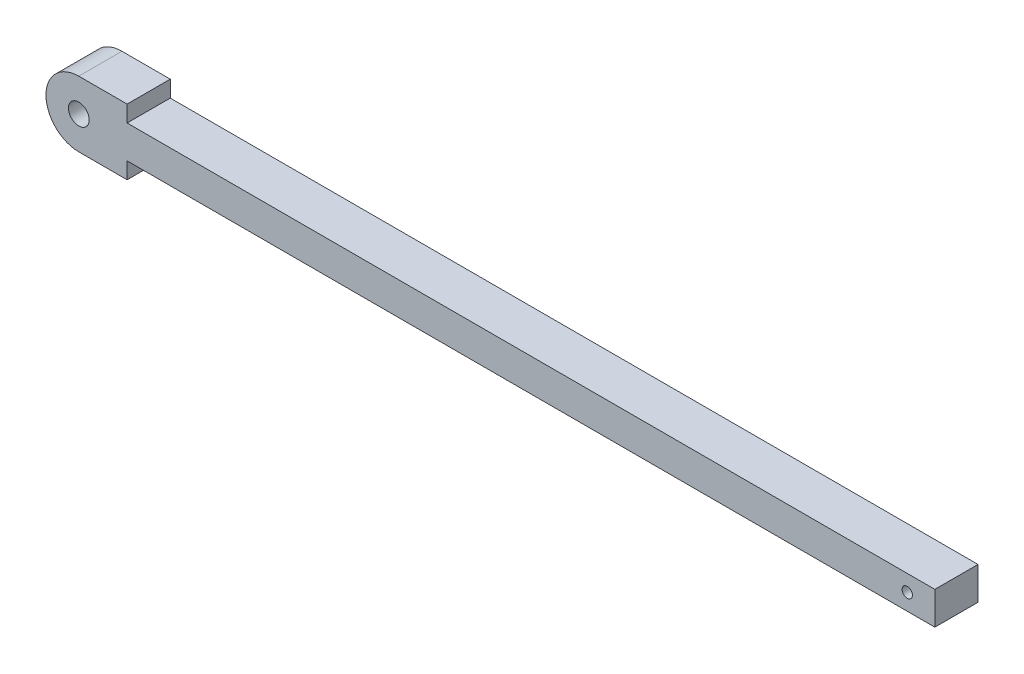
from build123d import *

# Parameters (mm, degrees)
BOSS_EXTRUDE1_DEPTH = 12.5
SKETCH2_R           = 3
SKETCH2_R_2         = 1.5
CUT_EXTRUDE1_DEPTH  = 20


with BuildPart() as part:
    # Sketch1 → Boss-Extrude1 (new body)
    with BuildSketch(Plane.XY):
        with BuildLine():
            Line((0, -9.5), (14, -9.5))
            Line((14, -9.5), (14, -4.75))
            Line((14, -4.75), (248, -4.75))
            Line((248, -4.75), (248, 4.75))
            Line((248, 4.75), (14, 4.75))
            Line((14, 4.75), (14, 9.5))
            Line((14, 9.5), (0, 9.5))
            ThreePointArc((0, 9.5), (-9.5, 0), (0, -9.5))
        make_face()
    extrude(amount=BOSS_EXTRUDE1_DEPTH)

    # Sketch2 → Cut-Extrude1 (cut, symmetric)
    with BuildSketch(Plane.XY):
        Circle(SKETCH2_R)
        with Locations((240, 0)):
            Circle(SKETCH2_R_2)
    extrude(amount=CUT_EXTRUDE1_DEPTH, both=True, mode=Mode.SUBTRACT)


solid = part.part
